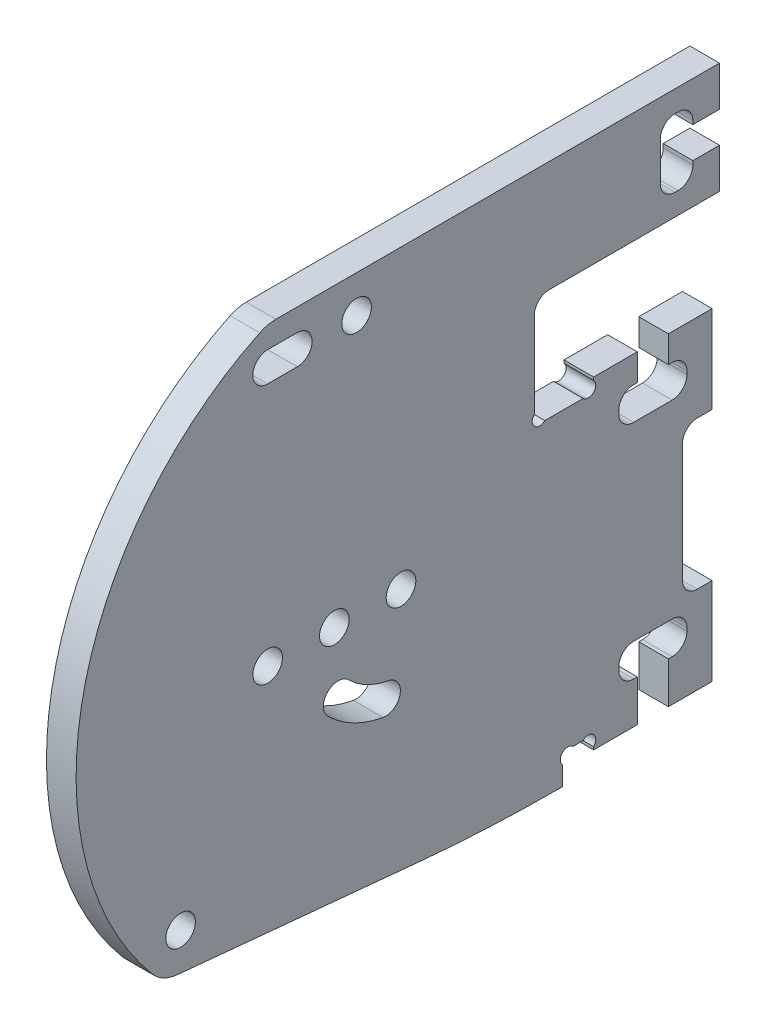
from build123d import *

# Parameters (mm, degrees)
SKETCH1_R           = 1
BASE_SHAPE_DEPTH    = 1
BOTTOM_FILLET_R     = 100
MILLING_FILLETS_R   = 1
MILL_START          = -2
SKETCH17_R          = 0.5
MILL_CUTS_1MM_DEPTH = 2


with BuildPart() as part:
    # Sketch1 → Base shape (new, symmetric)
    with BuildSketch(Plane(origin=(0, 0, 0), x_dir=(0, 0, -1), z_dir=(1, 0, 0))):
        with BuildLine():
            Line((13, 20), (9, 20))
            Line((9, 20), (9, 27.5))
            Line((9, 27.5), (21.5, 27.5))
            Line((21.5, 27.5), (21.5, 30.2))
            Line((21.5, 30.2), (19.7, 30.2))
            Line((19.7, 30.2), (19.7, 28.95))
            Line((19.7, 28.95), (17.5, 28.95))
            Line((17.5, 28.95), (17.5, 33.55))
            Line((17.5, 33.55), (19.7, 33.55))
            Line((19.7, 33.55), (19.7, 32.3))
            Line((19.7, 32.3), (21.5, 32.3))
            Line((21.5, 32.3), (21.5, 35))
            Line((21.5, 35), (-8.44638615, 35))
            ThreePointArc((-8.44638615, 35), (-9.003752396, 34.937076705), (-9.533061586, 34.751474294))
            ThreePointArc((-9.533061586, 34.751474294), (-21.444501682, 19.597102087), (-16.791629001, 0.891803961))
            ThreePointArc((-16.791629001, 0.891803961), (-15.933367715, 0.233892092), (-14.877548152, 0))
            Line((-14.877548152, 0), (-14.996910346, 0))
            Line((-14.996910346, 0), (5.9, -2))
            Line((5.9, -2), (10.9, -2))
            Line((10.9, -2), (10.9, 0))
            Line((10.9, 0), (13, 0))
            Line((13, 0), (13, -0.9))
            Line((13, -0.9), (15.95, -0.9))
            Line((15.95, -0.9), (15.95, 1.9))
            Line((15.95, 1.9), (14.7, 1.9))
            Line((14.7, 1.9), (14.7, 4.1))
            Line((14.7, 4.1), (19.3, 4.1))
            Line((19.3, 4.1), (19.3, 1.9))
            Line((19.3, 1.9), (18.05, 1.9))
            Line((18.05, 1.9), (18.05, -0.9))
            Line((18.05, -0.9), (21, -0.9))
            Line((21, -0.9), (21, 5))
            Line((21, 5), (19, 5))
            Line((19, 5), (19, 15))
            Line((19, 15), (21, 15))
            Line((21, 15), (21, 20.9))
            Line((21, 20.9), (18.05, 20.9))
            Line((18.05, 20.9), (18.05, 19.1))
            Line((18.05, 19.1), (19.3, 19.1))
            Line((19.3, 19.1), (19.3, 16.9))
            Line((19.3, 16.9), (14.7, 16.9))
            Line((14.7, 16.9), (14.7, 19.1))
            Line((14.7, 19.1), (15.95, 19.1))
            Line((15.95, 19.1), (15.95, 20.9))
            Line((15.95, 20.9), (13, 20.9))
            Line((13, 20.9), (13, 20))
        make_face()
        with BuildLine():
            ThreePointArc((-0.868240859, 10.07596123), (-0.05708131, 8.91750532), (-1.215537181, 8.106345718))
            ThreePointArc((-1.215537181, 8.106345718), (-3.232240261, 8.790924151), (-4.949747462, 10.050252526))
            ThreePointArc((-4.949747462, 10.050252526), (-4.949747471, 11.464466091), (-3.535533905, 11.464466093))
            ThreePointArc((-3.535533905, 11.464466093), (-2.308743052, 10.564945827), (-0.868240859, 10.07596123))
        make_face(mode=Mode.SUBTRACT)
        with Locations((-4.5, 15)):
            Circle(SKETCH1_R, mode=Mode.SUBTRACT)
        with Locations((-9, 15)):
            Circle(SKETCH1_R, mode=Mode.SUBTRACT)
        with Locations((-3, 32.5)):
            Circle(SKETCH1_R, mode=Mode.SUBTRACT)
        with Locations((0, 15)):
            Circle(SKETCH1_R, mode=Mode.SUBTRACT)
        with Locations((-14.877548152, 2.5)):
            Circle(SKETCH1_R, mode=Mode.SUBTRACT)
        with BuildLine():
            Line((-9, 33.5), (-7, 33.5))
            ThreePointArc((-7, 33.5), (-6, 32.5), (-7, 31.5))
            Line((-7, 31.5), (-9, 31.5))
            ThreePointArc((-9, 31.5), (-10, 32.5), (-9, 33.5))
        make_face(mode=Mode.SUBTRACT)
    extrude(amount=BASE_SHAPE_DEPTH, both=True)

    # Bottom fillet
    # the kernel refuses this fillet: 100 mm, written as the material it takes off along each edge
    with BuildSketch(Plane(origin=(-12.9362194, -2, -5.9), x_dir=(0, 0, -1), z_dir=(1, 0, 0))) as bottom_fillet_piece_1:
        with BuildLine():
            CenterArc((BOTTOM_FILLET_R * 0.0477448775998, BOTTOM_FILLET_R), BOTTOM_FILLET_R, 264.532991667, 5.467008333)
            Line((-BOTTOM_FILLET_R * 0.0475276967795, BOTTOM_FILLET_R * 0.00454877740235), (0, 0))
            Line((0, 0), (BOTTOM_FILLET_R * 0.0477448775998, 0))
        make_face()
    extrude(amount=25.8724388, mode=Mode.SUBTRACT)

    # Milling fillets
    milling_fillets_edges = [part.edges().sort_by_distance(p)[0] for p in [
        (0, 33.55, -19.7),
        (0, 33.55, -17.5),
        (0, 28.95, -17.5),
        (0, 28.95, -19.7),
        (0, 27.5, -9),
        (0, 19.1, -14.7),
        (0, 16.9, -14.7),
        (0, 16.9, -19.3),
        (0, 19.1, -19.3),
        (0, 15, -19),
        (0, 5, -19),
        (0, 1.9, -19.3),
        (0, 4.1, -19.3),
        (0, 4.1, -14.7),
        (0, 1.9, -14.7),
    ]]
    fillet(milling_fillets_edges, radius=MILLING_FILLETS_R)

    # Sketch17 → Mill cuts 1mm (cut)
    with BuildSketch(Plane(origin=(1, 0, 0), x_dir=(0, 0, -1), z_dir=(1, 0, 0)).offset(MILL_START)):
        with Locations((9.353553391, 20.353553391)):
            Circle(SKETCH17_R)
        with Locations((12.646446609, 20.353553391)):
            Circle(SKETCH17_R)
        with Locations((12.646446609, -0.353553391)):
            Circle(SKETCH17_R)
        with Locations((11.253553391, -0.353553391)):
            Circle(SKETCH17_R)
    extrude(amount=MILL_CUTS_1MM_DEPTH, mode=Mode.SUBTRACT)


solid = part.part
